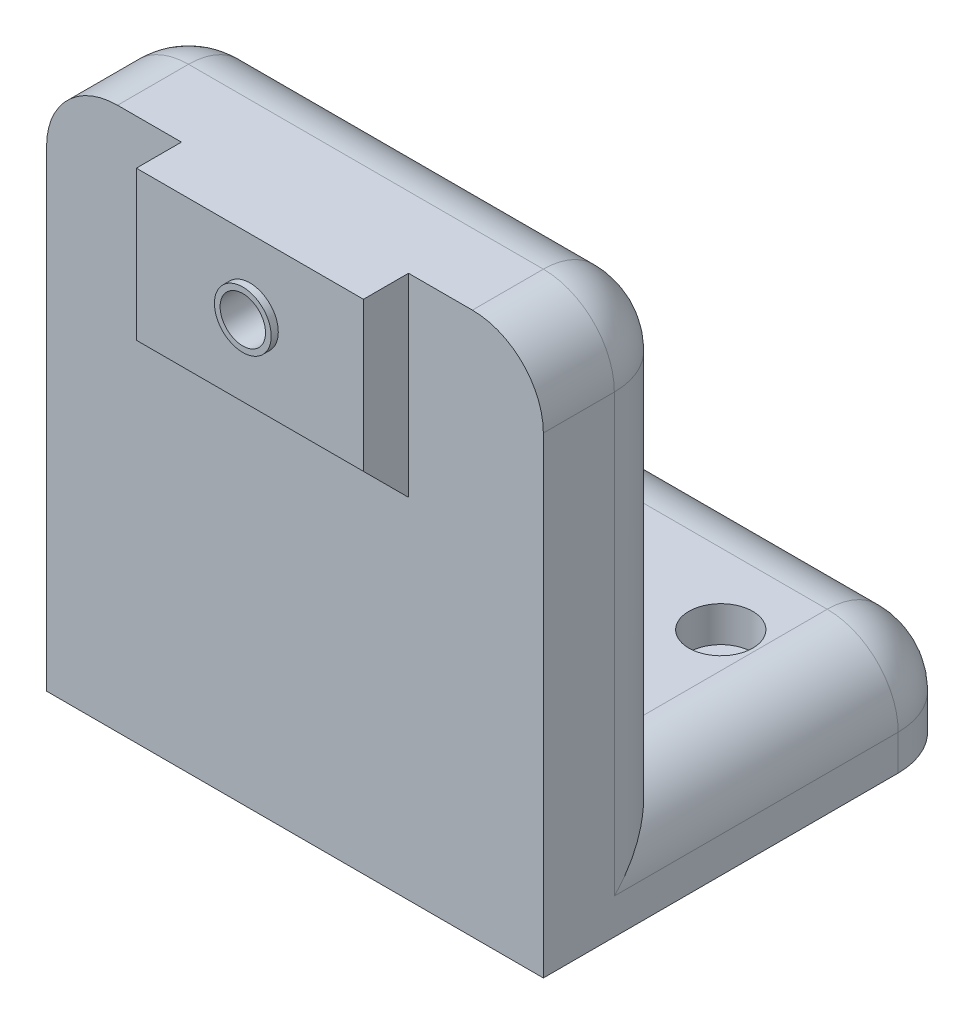
from build123d import *

# Parameters (mm, degrees)
SKETCH1_W           = 70
SKETCH1_H           = 60
BOSS_EXTRUDE1_DEPTH = 15
SKETCH2_W           = 70
SKETCH2_H           = 20
BOSS_EXTRUDE2_DEPTH = 61.5
SKETCH3_R           = 3.2
CUT_EXTRUDE1_DEPTH  = 10
SKETCH5_R           = 1.9
CUT_EXTRUDE2_DEPTH  = 111.825312993
SKETCH6_R           = 4.5
CUT_EXTRUDE3_DEPTH  = 5
FILLET1_R           = 10
BOSS_EXTRUDE3_START = 6.35
SKETCH7_W           = 32
SKETCH7_H           = 20
SKETCH7_R           = 3.2
BOSS_EXTRUDE3_DEPTH = 6.35
CHAMFER1_SIZE       = 7.35
BOSS_EXTRUDE4_START = 1
SKETCH8_R           = 4
SKETCH8_R_2         = 3.2
BOSS_EXTRUDE4_DEPTH = 1


with BuildPart() as part:
    # Sketch1 → Boss-Extrude1 (new body)
    with BuildSketch(Plane(origin=(0, 0, 0), x_dir=(1, 0, 0), z_dir=(0, 1, 0))):
        with Locations((35, 30)):
            Rectangle(SKETCH1_W, SKETCH1_H)
    extrude(amount=BOSS_EXTRUDE1_DEPTH)

    # Sketch2 → Boss-Extrude2 (add)
    with BuildSketch(Plane(origin=(0, 15, 0), x_dir=(1, 0, 0), z_dir=(0, 1, 0))):
        with Locations((35, 10)):
            Rectangle(SKETCH2_W, SKETCH2_H)
    extrude(amount=BOSS_EXTRUDE2_DEPTH)

    # Sketch3 → Cut-Extrude1 (cut)
    with BuildSketch(Plane.XY):
        with Locations((35, 66.5)):
            Circle(SKETCH3_R)
    extrude(amount=-CUT_EXTRUDE1_DEPTH, mode=Mode.SUBTRACT)

    # Sketch5 → Cut-Extrude2 (cut, through all)
    with BuildSketch(Plane(origin=(0, 15, 0), x_dir=(1, 0, 0), z_dir=(0, 1, 0))):
        with Locations(Location((15, 40, 0), (0, 0, 270))):
            Circle(SKETCH5_R)
        with Locations(Location((35, 40, 0), (0, 0, 270))):
            Circle(SKETCH5_R)
        with Locations(Location((55, 40, 0), (0, 0, 270))):
            Circle(SKETCH5_R)
    extrude(amount=-CUT_EXTRUDE2_DEPTH, mode=Mode.SUBTRACT)

    # Sketch6 → Cut-Extrude3 (cut)
    with BuildSketch(Plane(origin=(0, 15, 0), x_dir=(1, 0, 0), z_dir=(0, 1, 0))):
        with Locations(Location((15, 40, 0), (0, 0, 270))):
            Circle(SKETCH6_R)
        with Locations(Location((35, 40, 0), (0, 0, 270))):
            Circle(SKETCH6_R)
        with Locations(Location((55, 40, 0), (0, 0, 270))):
            Circle(SKETCH6_R)
    extrude(amount=-CUT_EXTRUDE3_DEPTH, mode=Mode.SUBTRACT)

    # Fillet1
    fillet1_edges = [part.edges().sort_by_distance(p)[0] for p in [
        (70, 15, -40),
        (0, 45.75, -20),
        (35, 15, -60),
        (70, 45.75, -20),
        (0, 76.5, -10),
        (70, 76.5, -10),
        (35, 76.5, -20),
        (0, 15, -40),
        (0, 7.5, -60),
        (70, 7.5, -60),
    ]]
    fillet(fillet1_edges, radius=FILLET1_R)

    # Sketch7 → Boss-Extrude3 (add)
    with BuildSketch(Plane.XY.offset(BOSS_EXTRUDE3_START)):
        with Locations((35, 66.5)):
            Rectangle(SKETCH7_W, SKETCH7_H)
        with Locations((35, 66.5)):
            Circle(SKETCH7_R, mode=Mode.SUBTRACT)
    extrude(amount=-BOSS_EXTRUDE3_DEPTH)

    # Chamfer1
    # the kernel refuses this chamfer: 7.35 mm, written as the material it adds along each edge
    with BuildSketch(Plane(origin=(51, 56.5, 0), x_dir=(0, -0.9996219169112966, -0.027495876610586365), z_dir=(-1, 0, 0))) as chamfer1_piece_1_section:
        Polygon((CHAMFER1_SIZE * 0.999621916911, CHAMFER1_SIZE * 0.0274958766106), (-CHAMFER1_SIZE * 0.0274958766106, CHAMFER1_SIZE * 0.999621916911), (0, 0), align=None)
    chamfer1_piece_1 = extrude(amount=32, mode=Mode.PRIVATE)
    chamfer1_piece_1 = split(chamfer1_piece_1, bisect_by=Plane(origin=(35, 54.008386108, 6.35), z_dir=(0, 0, -1)), keep=Keep.TOP, mode=Mode.PRIVATE)
    add(chamfer1_piece_1)

    # Sketch8 → Boss-Extrude4 (add)
    with BuildSketch(Plane.XY.offset(6.35).offset(BOSS_EXTRUDE4_START)):
        with Locations((35, 66.5)):
            Circle(SKETCH8_R)
        with Locations((35, 66.5)):
            Circle(SKETCH8_R_2, mode=Mode.SUBTRACT)
    extrude(amount=-BOSS_EXTRUDE4_DEPTH)


solid = part.part
